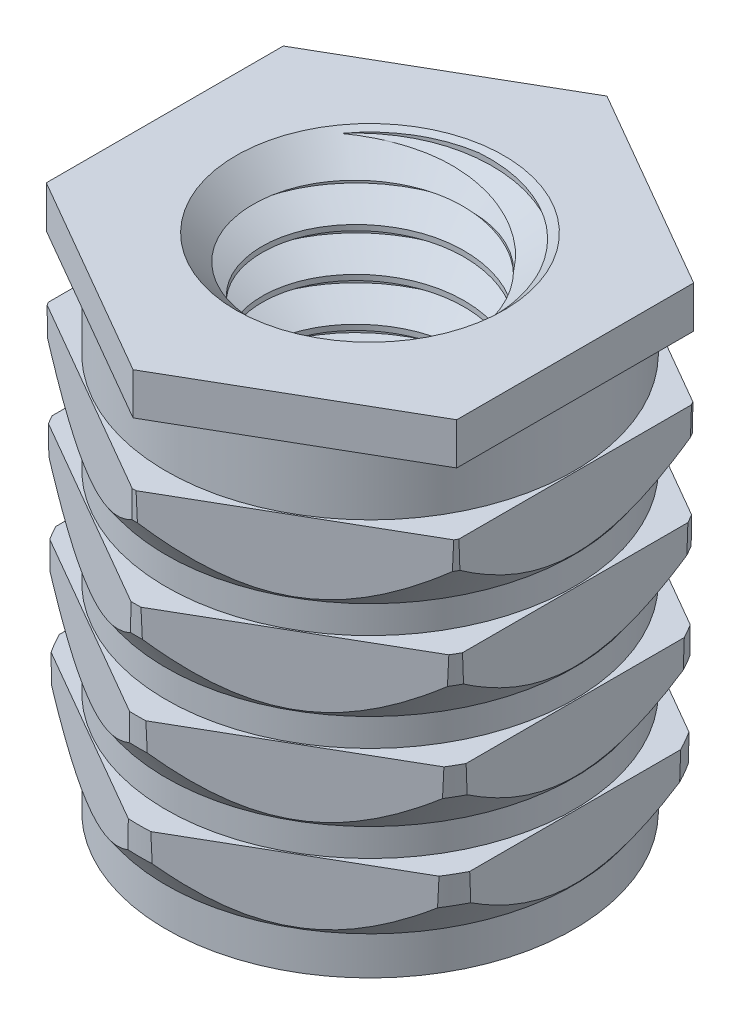
from build123d import *

# Parameters (mm, degrees)
EXTRUDE1_DEPTH         = 5.8
SKETCH4_R              = 1.175240474
EXTRUDE2_DEPTH         = 7.841159137
CHAMFER1_SIZE          = 0.375
CUT_SWEEP1_PITCH       = 0.5
CUT_SWEEP1_HEIGHT      = 6.8381
CUT_SWEEP1_RADIUS      = 1.5
CUT_SWEEP1_START_ANGLE = -90


with BuildPart() as part:
    # Sketch1 → Extrude1 (new body)
    with BuildSketch(Plane(origin=(0, 0, 0), x_dir=(1, 0, 0), z_dir=(0, 1, 0))):
        Polygon((0, 2.742413779), (-2.375, 1.371206889), (-2.375, -1.371206889), (0, -2.742413779), (2.375, -1.371206889), (2.375, 1.371206889), align=None)
    extrude(amount=-EXTRUDE1_DEPTH)

    # Sketch4 → Extrude2 (cut, through all)
    with BuildSketch(Plane(origin=(0, 0, 0), x_dir=(-1, 0, 0), z_dir=(0, 1, 0))):
        with Locations(Location((0, 0, 0), (0, 0, 90))):
            Circle(SKETCH4_R)
    extrude(amount=-EXTRUDE2_DEPTH, mode=Mode.SUBTRACT)

    # Chamfer1
    chamfer1_edges = [part.edges().sort_by_distance(p)[0] for p in [
        (0, -5.8, -1.175240474),
        (0, 0, -1.175240474),
    ]]
    chamfer(chamfer1_edges, length=CHAMFER1_SIZE)

    # Cut-Sweep1: sweep along a helix
    with BuildLine() as cut_sweep1_path:
        add(Helix(CUT_SWEEP1_PITCH, CUT_SWEEP1_HEIGHT, CUT_SWEEP1_RADIUS, center=(0, 0, 0), direction=(0, -1, 0), mode=Mode.PRIVATE).rotate(Axis((0, 0, 0), (0, -1, 0)), CUT_SWEEP1_START_ANGLE))
    # Sketch3 → Cut-Sweep1 (sweep, cut)
    with BuildSketch(Plane.XY):
        Polygon((-1.5, 0.0625), (-1.5, 0), (-1.14817718, -0.203125), (-1.14817718, 0.265625), align=None)
    sweep(path=cut_sweep1_path.line, is_frenet=True, mode=Mode.SUBTRACT)

    # Sketch5 → Cut-Revolve1 (revolve, cut)
    with BuildSketch(Plane.XY):
        Polygon((-2.36, -5.8), (-2.742413779, -5.8), (-3.124827557, -5.8), (-3.124827557, 0), (-2.742413779, 0), (-2.742413779, -0.483333333), (-2.36, -0.483333333), (-2.36, -1.208333333), (-2.729758857, -1.208333333), (-2.724174491, -1.52826143), (-2.36, -2.048356503), (-2.36, -2.368333333), (-2.709510981, -2.368333333), (-2.703926616, -2.68826143), (-2.36, -3.17943954), (-2.36, -3.499416371), (-2.689767853, -3.499416371), (-2.684183488, -3.819344467), (-2.36, -4.282326469), (-2.36, -4.602303299), (-2.67051689, -4.602303299), (-2.664932525, -4.922231395), (-2.36, -5.357720173), align=None)
    revolve(axis=Axis((0, 0, 0), (0, -1, 0)), mode=Mode.SUBTRACT)


solid = part.part
